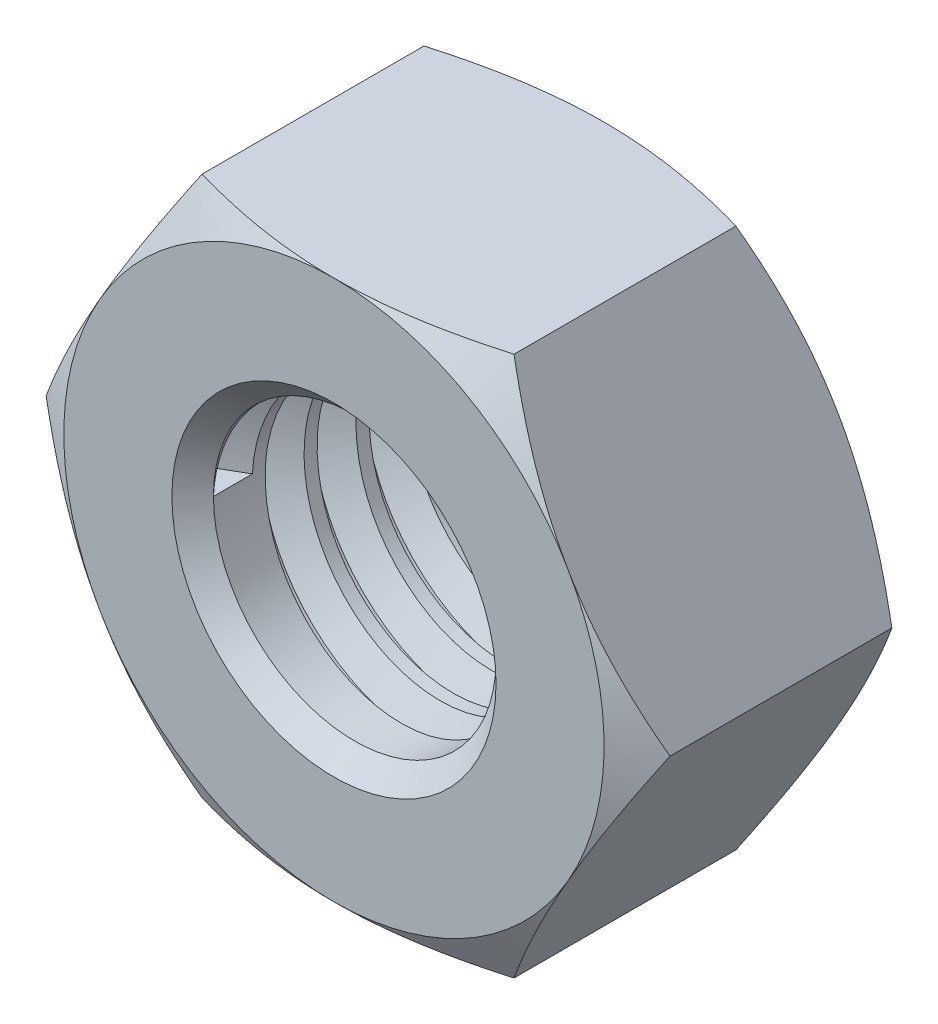
from build123d import *

# Parameters (mm, degrees)
SKETCH2_R           = 3.4
BOSS_EXTRUDE1_DEPTH = 6.5
CHAMFER1_SIZE       = 0.5
THREAD1_PITCH       = 1.25


with BuildPart() as part:
    # Sketch2 → Boss-Extrude1 (new body)
    with BuildSketch(Plane.XY):
        Polygon((-3.75277675, 6.5), (-7.505553499, 0), (-3.75277675, -6.5), (3.75277675, -6.5), (7.505553499, 0), (3.75277675, 6.5), align=None)
        with Locations(Location((0, 0, 0), (0, 0, 180))):
            Circle(SKETCH2_R, mode=Mode.SUBTRACT)
    extrude(amount=BOSS_EXTRUDE1_DEPTH)

    # Sketch3 → Cut-Revolve1 (revolve, cut)
    with BuildSketch(Plane(origin=(0, 0, 0), x_dir=(0, 0, -1), z_dir=(1, 0, 0))):
        Polygon((0, 6.5), (0, 9.5), (-1.732050808, 9.5), align=None)
        Polygon((-6.5, 6.5), (-6.5, 9.5), (-4.767949192, 9.5), align=None)
    revolve(axis=Axis((0, 0, 6.5), (0, 0, -1)), mode=Mode.SUBTRACT)

    # Chamfer1
    chamfer1_edges = [part.edges().sort_by_distance(p)[0] for p in [
        (3.4, 0, 0),
        (3.4, 0, 6.5),
    ]]
    chamfer(chamfer1_edges, length=CHAMFER1_SIZE)

    # Thread1: the profile of Thread Profile1 profile screwed along a right-hand helix of 4.8 turns, 8 arcs to a turn; built about Z, then put on its axis
    thread1_z = Axis((0, 0, 0), (0, 0, 1))
    thread1_corners = [(3.3997, 0, -0.000173205), (4.076582344, 0, 0.390624998), (4.076582344, 0, 0.546874998), (3.3997, 0, 0.937673202)]
    with BuildLine(mode=Mode.PRIVATE) as thread1_profile:
        Line(thread1_corners[0], thread1_corners[1])
        Line(thread1_corners[1], thread1_corners[2])
        Line(thread1_corners[2], thread1_corners[3])
        Line(thread1_corners[3], thread1_corners[0])
    thread1_cap = Face(thread1_profile.wire())
    thread1_turn_angles = [0, 22.5, 45, 67.5, 90, 112.5, 135, 157.5, 180, 202.5, 225, 247.5, 270, 292.5, 315, 337.5, 360]
    thread1_turn_weights = [1, 0.9238795325112867, 1, 0.9238795325112867, 1, 0.9238795325112867, 1, 0.9238795325112867, 1, 0.9238795325112867, 1, 0.9238795325112867, 1, 0.9238795325112867, 1, 0.9238795325112867, 1]
    thread1_turn_rails = [Edge.make_bspline([Vector(p[0], p[1], 0).rotate(thread1_z, thread1_turn_angles[k]) / thread1_turn_weights[k] + Vector(0, 0, p[2] + THREAD1_PITCH * thread1_turn_angles[k] / 360) for k in range(17)], [0, 0, 0, 1, 1, 2, 2, 3, 3, 4, 4, 5, 5, 6, 6, 7, 7, 8, 8, 8], 2, thread1_turn_weights) for p in thread1_corners]
    thread1_turn_sides = [Face.make_surface_from_curves(thread1_turn_rails[p[0]], thread1_turn_rails[p[1]]) for p in [(0, 1), (1, 2), (2, 3), (3, 0)]]
    thread1_last_angles = [1440, 1462.5, 1485, 1507.5, 1530, 1552.5, 1575, 1597.5, 1620, 1642.5, 1665, 1687.5, 1710, 1719, 1728]
    thread1_last_weights = [1, 0.9238795325112867, 1, 0.9238795325112867, 1, 0.9238795325112867, 1, 0.9238795325112867, 1, 0.9238795325112867, 1, 0.9238795325112867, 1, 0.9876883405951433, 1]
    thread1_last_rails = [Edge.make_bspline([Vector(p[0], p[1], 0).rotate(thread1_z, thread1_last_angles[k]) / thread1_last_weights[k] + Vector(0, 0, p[2] + THREAD1_PITCH * thread1_last_angles[k] / 360) for k in range(15)], [0, 0, 0, 1, 1, 2, 2, 3, 3, 4, 4, 5, 5, 6, 6, 7, 7, 7], 2, thread1_last_weights) for p in thread1_corners]
    thread1_last_sides = [Face.make_surface_from_curves(thread1_last_rails[p[0]], thread1_last_rails[p[1]]) for p in [(0, 1), (1, 2), (2, 3), (3, 0)]]
    thread1 = Plane(origin=(0, 0, 6), x_dir=(-1, 0, 0), z_dir=(0, 0, -1)) * Solid(Shell([*[p.moved(Location((0, 0, THREAD1_PITCH * i))) for i in range(4) for p in thread1_turn_sides], *thread1_last_sides, thread1_cap, thread1_cap.rotate(thread1_z, 1728).moved(Location((0, 0, THREAD1_PITCH * 1728 / 360)))]))
    add(thread1, mode=Mode.SUBTRACT)


solid = part.part
